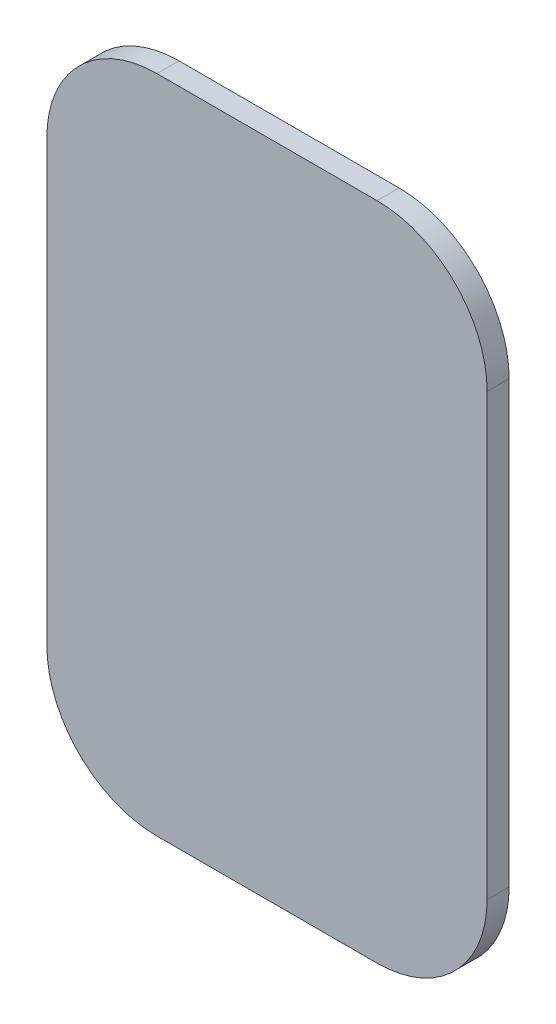
from build123d import *

# Parameters (mm, degrees)
BASE_FLANGE1_DEPTH = 2.54


# Sheet-metal steps are written as plain solids
with BuildPart() as part:
    # Sketch1 → Base-Flange1 (new body)
    with BuildSketch(Plane.XY):
        with BuildLine():
            Line((26.483892015, -25.264510752), (26.483892015, 25.535489248))
            ThreePointArc((26.483892015, 25.535489248), (22.764148136, 34.515745369), (13.783892015, 38.235489248))
            Line((13.783892015, 38.235489248), (-11.616064043, 38.235489248))
            ThreePointArc((-11.616064043, 38.235489248), (-20.596320164, 34.515745369), (-24.316064043, 25.535489248))
            Line((-24.316064043, 25.535489248), (-24.316064043, -25.264510752))
            ThreePointArc((-24.316064043, -25.264510752), (-20.596320164, -34.244766873), (-11.616064043, -37.964510752))
            Line((-11.616064043, -37.964510752), (13.783892015, -37.964510752))
            ThreePointArc((13.783892015, -37.964510752), (22.764148136, -34.244766873), (26.483892015, -25.264510752))
        make_face()
    extrude(amount=-BASE_FLANGE1_DEPTH)


solid = part.part
